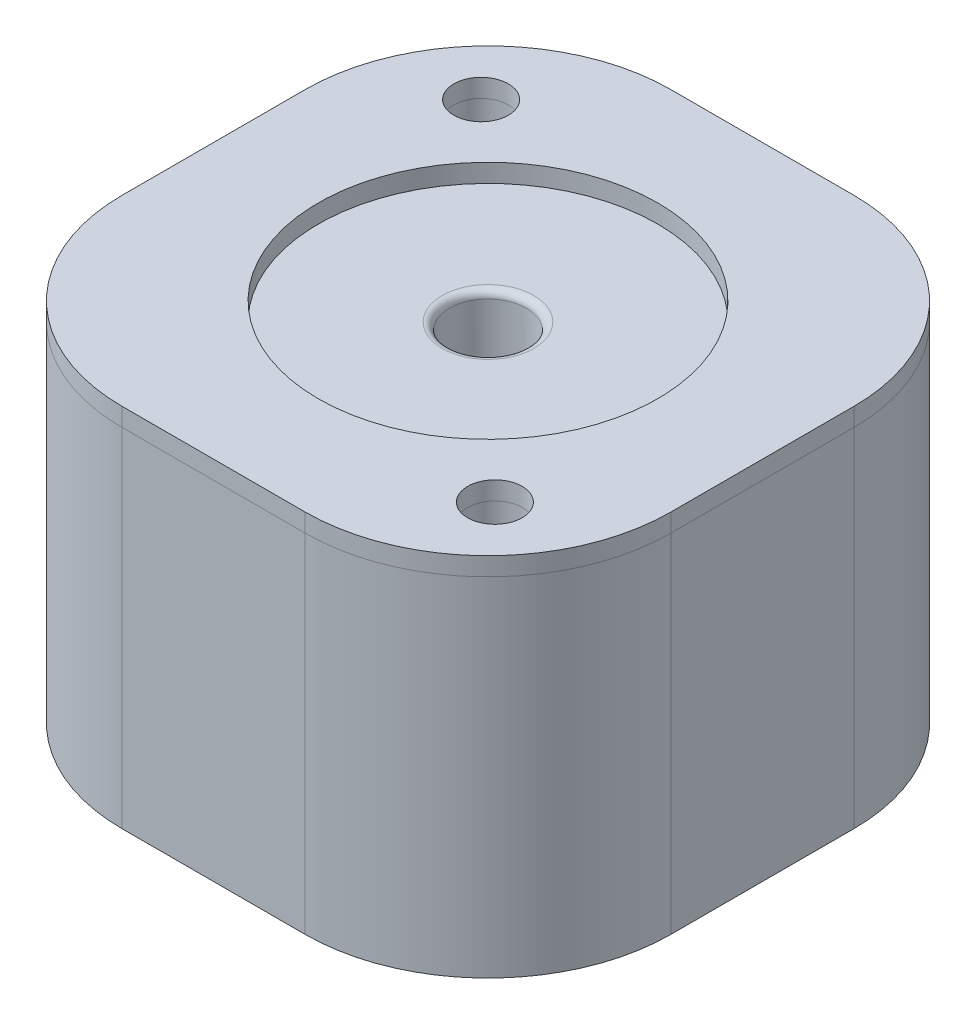
from build123d import *

# Parameters (mm, degrees)
SKIZZE1_W                       = 30
SKIZZE1_H                       = 30
AUFSATZ_LINEAR_AUSTRAGEN1_DEPTH = 20
VERRUNDUNG1_R                   = 10
SKIZZE3_R                       = 1.49
SCHNITT_LINEAR_AUSTRAGEN1_DEPTH = 15
KREISMUSTER1_COUNT              = 2
ABSPALTEN1_SURFACE_1_BACK       = 47.904
ABSPALTEN1_SURFACE_1_DEPTH      = 95.808
ABSPALTEN1_SURFACE_2_BACK       = 47.904
ABSPALTEN1_SURFACE_2_DEPTH      = 95.808


# Read off the part's stored shape, not the designer's step: Formnest1
with BuildPart() as part:
    # Skizze1 → Aufsatz-Linear austragen1 (new body)
    with BuildSketch(Plane(origin=(0, 0, 0), x_dir=(1, 0, 0), z_dir=(0, 1, 0))):
        Rectangle(SKIZZE1_W, SKIZZE1_H)
    extrude(amount=AUFSATZ_LINEAR_AUSTRAGEN1_DEPTH)

    # Formnest1 outline → Formnest1 (revolve, cut)
    with BuildSketch(Plane.XY):
        with BuildLine():
            Line((2.5075, 18.997), (9.27775, 18.997))
            Line((9.27775, 18.997), (9.27775, 20))
            Line((9.27775, 20), (0, 20))
            Line((0, 20), (0, 11.976))
            Line((0, 11.976), (2.1063, 11.976))
            Line((2.1063, 11.976), (3.009, 14.985))
            Line((3.009, 14.985), (2.5075, 14.985))
            ThreePointArc((2.5075, 14.985), (2.223808759, 15.102508759), (2.1063, 15.3862))
            Line((2.1063, 15.3862), (2.1063, 18.5958))
            ThreePointArc((2.1063, 18.5958), (2.223808759, 18.879491241), (2.5075, 18.997))
        make_face()
    revolve(axis=Axis((0, 0, 0), (0, 1, 0)), mode=Mode.SUBTRACT)

    # Verrundung1
    verrundung1_edges = [part.edges().sort_by_distance(p)[0] for p in [
        (-15, 10, -15),
        (15, 10, -15),
        (15, 10, 15),
        (-15, 10, 15),
    ]]
    fillet(verrundung1_edges, radius=VERRUNDUNG1_R)

    # Skizze3 → Schnitt-Linear austragen1 (cut)
    with BuildSketch(Plane(origin=(0, 20, 0), x_dir=(1, 0, 0), z_dir=(0, 1, 0))):
        with Locations(Location((-9.718159066, 9.341055177, 0), (0, 0, 270))):
            Circle(SKIZZE3_R)
    schnitt_linear_austragen1 = extrude(amount=-SCHNITT_LINEAR_AUSTRAGEN1_DEPTH, mode=Mode.SUBTRACT)

    # Kreismuster1: Schnitt-Linear austragen1 ×2 about axis
    kreismuster1_axis = Axis((0, 0, 0), (0, 1, 0))
    for i in range(1, KREISMUSTER1_COUNT):
        add(schnitt_linear_austragen1.rotate(kreismuster1_axis, i * 360 / KREISMUSTER1_COUNT), mode=Mode.SUBTRACT)


with BuildPart() as body_2:
    # Abspalten1: the piece behind the surface
    add(part.part)
    # Abspalten1 surface: a surface, the sketch's curves swept straight by 95.808 mm
    with BuildLine(Plane.XY.offset(15).offset(-ABSPALTEN1_SURFACE_1_BACK), mode=Mode.PRIVATE) as abspalten1_surface_1_path:
        Line((-15, 19), (15, 19))
    abspalten1_surface_1 = Shell.extrude(abspalten1_surface_1_path.wire(), (0 * ABSPALTEN1_SURFACE_1_DEPTH, 0 * ABSPALTEN1_SURFACE_1_DEPTH, 1 * ABSPALTEN1_SURFACE_1_DEPTH))
    split(bisect_by=abspalten1_surface_1, keep=Keep.BOTTOM)


with BuildPart() as part_1:
    add(part.part)

    # Abspalten1: split by a surface, the side it looks to stays
    # Abspalten1 surface: a surface, the sketch's curves swept straight by 95.808 mm
    with BuildLine(Plane.XY.offset(15).offset(-ABSPALTEN1_SURFACE_2_BACK), mode=Mode.PRIVATE) as abspalten1_surface_2_path:
        Line((-15, 19), (15, 19))
    abspalten1_surface_2 = Shell.extrude(abspalten1_surface_2_path.wire(), (0 * ABSPALTEN1_SURFACE_2_DEPTH, 0 * ABSPALTEN1_SURFACE_2_DEPTH, 1 * ABSPALTEN1_SURFACE_2_DEPTH))
    split(bisect_by=abspalten1_surface_2, keep=Keep.TOP)


solid = Compound([body_2.part, part_1.part])
